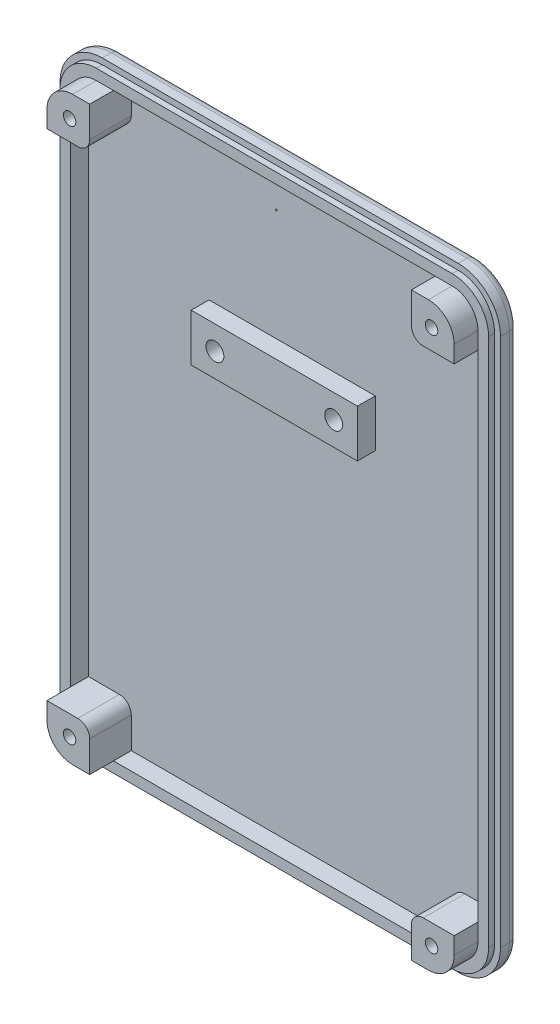
from build123d import *

# Parameters (mm, degrees)
SKIZZE1_R                         = 0.1414
SKIZZE1_W                         = 28
SKIZZE1_H                         = 8
AUFSATZ_LINEAR_AUSTRAGEN1_DEPTH   = 1
SKIZZE1_4_R                       = 1.5
SKIZZE1_4_R_2                     = 1
AUFSATZ_LINEAR_AUSTRAGEN3_DEPTH   = 1
AUFSATZ_LINEAR_AUSTRAGEN3_2_DEPTH = 1
SKIZZE1_5_W                       = 28
SKIZZE1_5_H                       = 8
SKIZZE1_5_R                       = 1.5
AUFSATZ_LINEAR_AUSTRAGEN4_DEPTH   = 4
AUFSATZ_LINEAR_AUSTRAGEN6_DEPTH   = 1
AUFSATZ_LINEAR_START              = 2.6
SKIZZE1_8_R                       = 2.1
SKIZZE1_8_R_2                     = 1.8596
SKIZZE1_8_R_3                     = 1.05
AUFSATZ_LINEAR_AUSTRAGEN7_DEPTH   = 5.4
SKIZZE1_9_R                       = 2.1
AUFSATZ_LINEAR_AUSTRAGEN8_DEPTH   = 8
AUFSATZ_LINEAR_AUSTRAGEN10_DEPTH  = 4
AUFSATZ_LINEAR_AUSTRAGEN11_DEPTH  = 3
VERRUNDUNG2_R                     = 1.5


# Read off the part's stored shape, not the designer's step: Aufsatz-Linear austragen10, Aufsatz-Linear austragen11
with BuildPart() as part:
    # Skizze1 → Aufsatz-Linear austragen1 (new body)
    with BuildSketch(Plane.XY):
        with BuildLine():
            Line((61.383894873, 92.591144656), (61.384358272, 97.788979988))
            Line((61.384358272, 97.788979988), (7.204358721, 97.781023656))
            Line((7.204358721, 97.781023656), (7.203896462, 92.595974926))
            ThreePointArc((7.203896462, 92.595974926), (6.617983946, 91.181813594), (5.203718166, 90.596153239))
            Line((5.203718166, 90.596153239), (1.077e-06, 90.596617162))
            Line((1.077e-06, 90.596617162), (1.077e-06, 7.200000174))
            Line((1.077e-06, 7.200000174), (5.200000687, 7.200000174))
            ThreePointArc((5.200000687, 7.200000174), (6.614214249, 6.614213736), (7.200000687, 5.200000174))
            Line((7.200000687, 5.200000174), (7.200000687, 1.74e-07))
            Line((7.200000687, 1.74e-07), (61.379999313, 1.484e-06))
            Line((61.379999313, 1.484e-06), (61.379999313, 5.200000174))
            ThreePointArc((61.379999313, 5.200000174), (61.965785751, 6.614213736), (63.379999313, 7.200000174))
            Line((63.379999313, 7.200000174), (68.58, 7.200000174))
            Line((68.58, 7.200000174), (68.58, 90.590503098))
            Line((68.58, 90.590503098), (63.383716561, 90.590966359))
            ThreePointArc((63.383716561, 90.590966359), (61.969555228, 91.176878875), (61.383894873, 92.591144656))
        make_face()
        with Locations((31.602, 91.046)):
            Circle(SKIZZE1_R, mode=Mode.SUBTRACT)
        Polygon((32.79, 91.48), (31.79, 91.48), (31.79, 92.48), align=None, mode=Mode.SUBTRACT)
        with Locations((34.29, 68.283532534)):
            Rectangle(SKIZZE1_W, SKIZZE1_H, mode=Mode.SUBTRACT)
    extrude(amount=AUFSATZ_LINEAR_AUSTRAGEN1_DEPTH)



with BuildPart() as body_2:
    # Skizze1<4> → Aufsatz-Linear austragen3 (new body)
    with BuildSketch(Plane.XY):
        with Locations((44.29, 68.283532534)):
            Circle(SKIZZE1_4_R)
        with Locations((44.29, 68.283532534)):
            Circle(SKIZZE1_4_R_2, mode=Mode.SUBTRACT)
    extrude(amount=AUFSATZ_LINEAR_AUSTRAGEN3_DEPTH)


with BuildPart() as body_3:
    # Skizze1<4> → Aufsatz-Linear austragen3 2 (new body)
    with BuildSketch(Plane.XY):
        with Locations((24.29, 68.283532534)):
            Circle(SKIZZE1_4_R)
        with Locations((24.29, 68.283532534)):
            Circle(SKIZZE1_4_R_2, mode=Mode.SUBTRACT)
    extrude(amount=AUFSATZ_LINEAR_AUSTRAGEN3_2_DEPTH)


with BuildPart() as part_1:
    add(part.part)

    add(body_2.part)  # Aufsatz-Linear austragen4 merges body 2

    add(body_3.part)  # Aufsatz-Linear austragen4 merges body 3
    # Skizze1<5> → Aufsatz-Linear austragen4 (add)
    with BuildSketch(Plane.XY):
        with Locations((34.29, 68.283532534)):
            Rectangle(SKIZZE1_5_W, SKIZZE1_5_H)
        with Locations((24.29, 68.283532534)):
            Circle(SKIZZE1_5_R, mode=Mode.SUBTRACT)
        with Locations((44.29, 68.283532534)):
            Circle(SKIZZE1_5_R, mode=Mode.SUBTRACT)
    extrude(amount=AUFSATZ_LINEAR_AUSTRAGEN4_DEPTH)

    # Skizze1<7> → Aufsatz-Linear austragen6 (add)
    with BuildSketch(Plane.XY):
        Polygon((31.79, 92.48), (32.79, 91.48), (31.79, 91.48), align=None)
    extrude(amount=AUFSATZ_LINEAR_AUSTRAGEN6_DEPTH)



with BuildPart() as body_2_2:
    # Skizze1<8> → Aufsatz-Linear austragen7 (new body)
    # profile 1 of 8: a face of its own
    with BuildSketch(Plane.XY.offset(AUFSATZ_LINEAR_START)):
        with Locations(Location((3.814019711, 93.986277321, 0), (0, 0, 180))):
            Circle(SKIZZE1_8_R)
        with Locations((3.81, 93.98)):
            Circle(SKIZZE1_8_R_2, mode=Mode.SUBTRACT)
    # profile 2 of 8: a face of its own
    with BuildSketch(Plane.XY.offset(AUFSATZ_LINEAR_START)):
        with Locations((3.81, 93.98)):
            Circle(SKIZZE1_8_R_2)
        with Locations(Location((3.814019711, 93.986277321, 0), (0, 0, 180))):
            Circle(SKIZZE1_8_R_3, mode=Mode.SUBTRACT)
    # profile 3 of 8: a face of its own
    with BuildSketch(Plane.XY.offset(AUFSATZ_LINEAR_START)):
        with Locations(Location((64.774019468, 93.980842598, 0), (0, 0, 180))):
            Circle(SKIZZE1_8_R)
        with Locations((64.77, 93.98)):
            Circle(SKIZZE1_8_R_2, mode=Mode.SUBTRACT)
    # profile 4 of 8: a face of its own
    with BuildSketch(Plane.XY.offset(AUFSATZ_LINEAR_START)):
        with Locations((64.77, 93.98)):
            Circle(SKIZZE1_8_R_2)
        with Locations(Location((64.774019468, 93.980842598, 0), (0, 0, 180))):
            Circle(SKIZZE1_8_R_3, mode=Mode.SUBTRACT)
    # profile 5 of 8: a face of its own
    with BuildSketch(Plane.XY.offset(AUFSATZ_LINEAR_START)):
        with Locations(Location((64.77, 3.81, 0), (0, 0, 180))):
            Circle(SKIZZE1_8_R)
        with Locations((64.77, 3.81)):
            Circle(SKIZZE1_8_R_2, mode=Mode.SUBTRACT)
    # profile 6 of 8: a face of its own
    with BuildSketch(Plane.XY.offset(AUFSATZ_LINEAR_START)):
        with Locations((64.77, 3.81)):
            Circle(SKIZZE1_8_R_2)
        with Locations(Location((64.77, 3.81, 0), (0, 0, 180))):
            Circle(SKIZZE1_8_R_3, mode=Mode.SUBTRACT)
    # profile 7 of 8: a face of its own
    with BuildSketch(Plane.XY.offset(AUFSATZ_LINEAR_START)):
        with Locations(Location((3.81, 3.81, 0), (0, 0, 180))):
            Circle(SKIZZE1_8_R)
        with Locations((3.81, 3.81)):
            Circle(SKIZZE1_8_R_2, mode=Mode.SUBTRACT)
    # profile 8 of 8: a face of its own
    with BuildSketch(Plane.XY.offset(AUFSATZ_LINEAR_START)):
        with Locations((3.81, 3.81)):
            Circle(SKIZZE1_8_R_2)
        with Locations(Location((3.81, 3.81, 0), (0, 0, 180))):
            Circle(SKIZZE1_8_R_3, mode=Mode.SUBTRACT)
    extrude(amount=AUFSATZ_LINEAR_AUSTRAGEN7_DEPTH)


with BuildPart() as part_2:
    add(part_1.part)

    add(body_2_2.part)  # Aufsatz-Linear austragen8 merges body 2 2
    # Skizze1<9> → Aufsatz-Linear austragen8 (add)
    # profile 1 of 6: a face of its own
    with BuildSketch(Plane.XY):
        with BuildLine():
            Line((2.8575, 7.200000174), (1.077e-06, 7.200000174))
            Line((1.077e-06, 7.200000174), (1.077e-06, 4.336))
            ThreePointArc((1.077e-06, 4.336), (1.269986148, 1.269985027), (4.336001182, 1.05e-07))
            Line((4.336001182, 1.05e-07), (7.200000687, 1.74e-07))
            Line((7.200000687, 1.74e-07), (7.200000687, 5.200000174))
            ThreePointArc((7.200000687, 5.200000174), (7.106910999, 5.803069872), (6.836307626, 6.35))
            Line((6.836307626, 6.35), (2.8575, 6.35))
            Line((2.8575, 6.35), (2.8575, 7.200000174))
        make_face()
        with Locations((3.81, 3.81)):
            Circle(SKIZZE1_9_R, mode=Mode.SUBTRACT)
    # profile 2 of 6: a face of its own
    with BuildSketch(Plane.XY):
        with BuildLine():
            Line((5.200000687, 7.200000174), (2.8575, 7.200000174))
            Line((2.8575, 7.200000174), (2.8575, 6.35))
            Line((2.8575, 6.35), (6.836307626, 6.35))
            ThreePointArc((6.836307626, 6.35), (6.121955227, 6.97482406), (5.200000687, 7.200000174))
        make_face()
    # profile 3 of 6: a face of its own
    with BuildSketch(Plane.XY):
        with BuildLine():
            Line((65.6575, 6.35), (65.6575, 7.200000174))
            Line((65.6575, 7.200000174), (63.379999313, 7.200000174))
            ThreePointArc((63.379999313, 7.200000174), (62.458044773, 6.97482406), (61.743692374, 6.35))
            Line((61.743692374, 6.35), (65.6575, 6.35))
        make_face()
    # profile 4 of 6: a face of its own
    with BuildSketch(Plane.XY):
        with BuildLine():
            Line((68.58, 4.336001553), (68.58, 7.200000174))
            Line((68.58, 7.200000174), (65.6575, 7.200000174))
            Line((65.6575, 7.200000174), (65.6575, 6.35))
            Line((65.6575, 6.35), (61.743692374, 6.35))
            ThreePointArc((61.743692374, 6.35), (61.473089001, 5.803069872), (61.379999313, 5.200000174))
            Line((61.379999313, 5.200000174), (61.379999313, 1.484e-06))
            Line((61.379999313, 1.484e-06), (64.244001182, 1.553e-06))
            ThreePointArc((64.244001182, 1.553e-06), (67.310015421, 1.269986968), (68.58, 4.336001553))
        make_face()
        with Locations((64.77, 3.81)):
            Circle(SKIZZE1_9_R, mode=Mode.SUBTRACT)
    # profile 5 of 6: a face of its own
    with BuildSketch(Plane.XY):
        with BuildLine():
            ThreePointArc((68.58, 93.454501553), (67.310153807, 96.519979186), (64.2445, 97.7894))
            Line((64.2445, 97.7894), (61.384358272, 97.788979988))
            Line((61.384358272, 97.788979988), (61.383894873, 92.591144656))
            ThreePointArc((61.383894873, 92.591144656), (61.969555228, 91.176878875), (63.383716561, 90.590966359))
            Line((63.383716561, 90.590966359), (68.58, 90.590503098))
            Line((68.58, 90.590503098), (68.58, 93.454501553))
        make_face()
        with Locations((64.774019468, 93.980842598)):
            Circle(SKIZZE1_9_R, mode=Mode.SUBTRACT)
    # profile 6 of 6: a face of its own
    with BuildSketch(Plane.XY):
        with BuildLine():
            Line((7.203896462, 92.595974926), (7.204358721, 97.781023656))
            Line((7.204358721, 97.781023656), (4.3194, 97.7806))
            ThreePointArc((4.3194, 97.7806), (1.266379599, 96.513808779), (1.077e-06, 93.46061717))
            Line((1.077e-06, 93.46061717), (1.077e-06, 90.596617162))
            Line((1.077e-06, 90.596617162), (5.203718166, 90.596153239))
            ThreePointArc((5.203718166, 90.596153239), (6.617983946, 91.181813594), (7.203896462, 92.595974926))
        make_face()
        with Locations((3.814019711, 93.986277321)):
            Circle(SKIZZE1_9_R, mode=Mode.SUBTRACT)
    extrude(amount=AUFSATZ_LINEAR_AUSTRAGEN8_DEPTH)

    # Aufsatz-Linear austragen10 outline → Aufsatz-Linear austragen10 (add)
    with BuildSketch(Plane.XY):
        with BuildLine():
            Line((-1.799998934, 93.461512972), (-1.799998923, 4.336))
            ThreePointArc((-1.799998923, 4.336), (-0.002806042, -0.002807194), (4.336001226, -1.799999895))
            Line((4.336001226, -1.799999895), (64.244001226, -1.799998447))
            ThreePointArc((64.244001226, -1.799998447), (68.582807643, -0.002805223), (70.38, 4.336001553))
            Line((70.38, 4.336001553), (70.38, 93.454479711))
            ThreePointArc((70.38, 93.454479711), (68.58285381, 97.792863588), (64.244217377, 99.589399978))
            Line((64.244217377, 99.589399978), (4.318250116, 99.580599863))
            ThreePointArc((4.318250116, 99.580599863), (-0.006502478, 97.786511193), (-1.799998934, 93.461512972))
        make_face()
        with BuildLine():
            Line((68.58, 93.454501553), (68.58, 4.336001553))
            ThreePointArc((68.58, 4.336001553), (67.310015421, 1.269986968), (64.244001182, 1.553e-06))
            Line((64.244001182, 1.553e-06), (61.379999313, 1.484e-06))
            Line((61.379999313, 1.484e-06), (7.200000687, 1.74e-07))
            Line((7.200000687, 1.74e-07), (4.336001182, 1.05e-07))
            ThreePointArc((4.336001182, 1.05e-07), (1.269986148, 1.269985027), (1.077e-06, 4.336))
            Line((1.077e-06, 4.336), (1.077e-06, 93.46061717))
            ThreePointArc((1.077e-06, 93.46061717), (1.266379599, 96.513808779), (4.3194, 97.7806))
            Line((4.3194, 97.7806), (7.204358721, 97.781023656))
            Line((7.204358721, 97.781023656), (61.384358272, 97.788979988))
            Line((61.384358272, 97.788979988), (64.2445, 97.7894))
            ThreePointArc((64.2445, 97.7894), (67.310153807, 96.519979186), (68.58, 93.454501553))
        make_face(mode=Mode.SUBTRACT)
    extrude(amount=AUFSATZ_LINEAR_AUSTRAGEN10_DEPTH)

    # Aufsatz-Linear austragen11 outline → Aufsatz-Linear austragen11 (add)
    with BuildSketch(Plane.XY):
        with BuildLine():
            ThreePointArc((-2.799998923, 4.336), (-0.709912815, -0.709913984), (4.33600125, -2.799999895))
            Line((4.33600125, -2.799999895), (64.24400125, -2.799998447))
            ThreePointArc((64.24400125, -2.799998447), (69.289914432, -0.709911996), (71.38, 4.336001553))
            Line((71.38, 4.336001553), (71.38, 93.454472112))
            ThreePointArc((71.38, 93.454472112), (69.289909532, 98.500021425), (64.244065367, 100.589399966))
            Line((64.244065367, 100.589399966), (4.317681591, 100.580599611))
            ThreePointArc((4.317681591, 100.580599611), (-0.71365933, 98.493567657), (-2.799998754, 93.461939525))
            Line((-2.799998754, 93.461939525), (-2.799998923, 4.336))
        make_face()
        with BuildLine():
            ThreePointArc((4.336001226, -1.799999895), (-0.002806042, -0.002807194), (-1.799998923, 4.336))
            Line((-1.799998923, 4.336), (-1.799998934, 93.461512972))
            ThreePointArc((-1.799998934, 93.461512972), (-0.006502478, 97.786511193), (4.318250116, 99.580599863))
            Line((4.318250116, 99.580599863), (64.244217377, 99.589399978))
            ThreePointArc((64.244217377, 99.589399978), (68.58285381, 97.792863588), (70.38, 93.454479711))
            Line((70.38, 93.454479711), (70.38, 4.336001553))
            ThreePointArc((70.38, 4.336001553), (68.582807643, -0.002805223), (64.244001226, -1.799998447))
            Line((64.244001226, -1.799998447), (4.336001226, -1.799999895))
        make_face(mode=Mode.SUBTRACT)
    extrude(amount=AUFSATZ_LINEAR_AUSTRAGEN11_DEPTH)

    # Verrundung2
    verrundung2_edges = [part_2.edges().sort_by_distance(p)[0] for p in [
        (-0.709912815, -0.709913984, 0),
        (34.29000125, -2.799999171, 0),
        (69.289914432, -0.709911996, 0),
        (71.38, 48.895236833, 0),
        (69.289909532, 98.500021425, 0),
        (34.280873479, 100.584999788, 0),
        (-0.71365933, 98.493567657, 0),
        (-2.799998839, 48.898969763, 0),
    ]]
    fillet(verrundung2_edges, radius=VERRUNDUNG2_R)


solid = part_2.part
